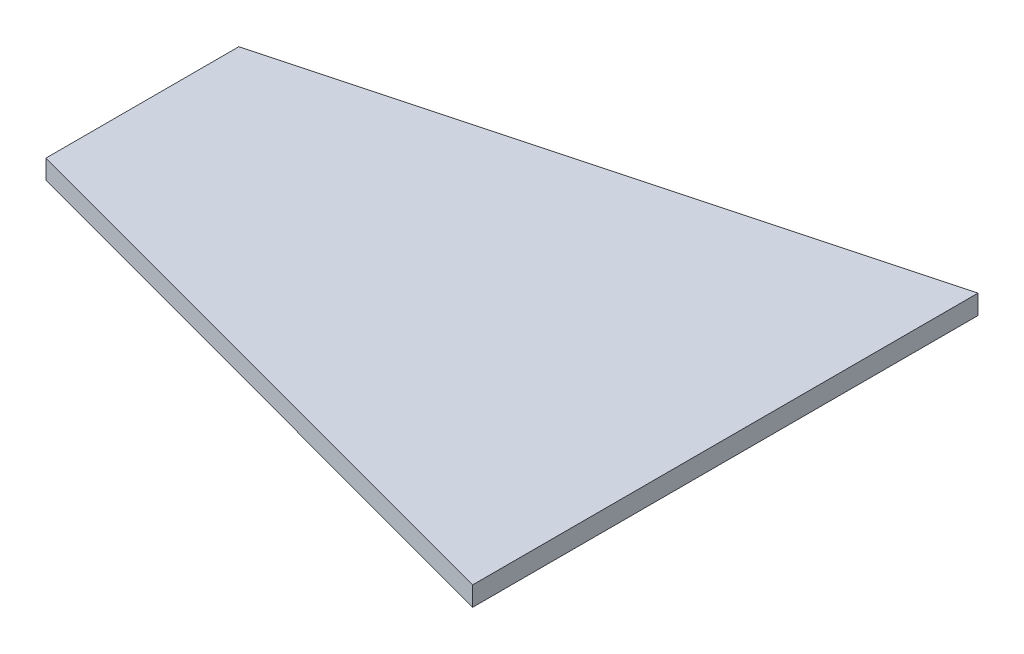
from build123d import *

# Parameters (mm, degrees)
BOSS_EXTRUDE1_DEPTH = 3.175


with BuildPart() as part:
    # Sketch1 → Boss-Extrude1 (new body)
    with BuildSketch(Plane(origin=(0, 0, 0), x_dir=(1, 0, 0), z_dir=(0, 1, 0))):
        Polygon((0, 0), (0, 82.55), (-95.25, 57.023), (-95.25, 25.527), align=None)
    extrude(amount=BOSS_EXTRUDE1_DEPTH)


solid = part.part
